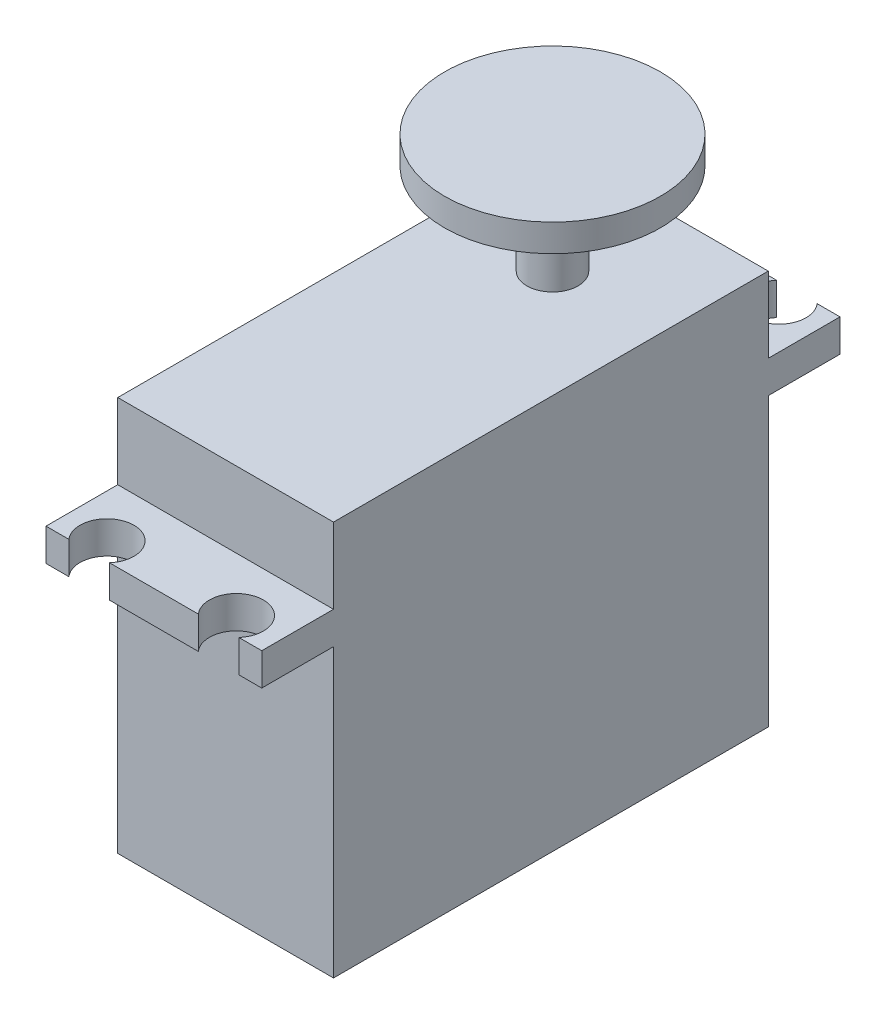
from build123d import *

# Parameters (mm, degrees)
GEAR_START  = 47.6
SKETCH4_R   = 10
GEAR_DEPTH  = 2.54
SKETCH1_W   = 20
SKETCH1_H   = 40.3
BODY_DEPTH  = 36.6
AXLE_REACH  = 50.556
SKETCH2_R   = 2.38125
WINGS_START = 26.6
WINGS_DEPTH = 3


with BuildPart() as part:
    # Sketch4 → Gear (new body)
    with BuildSketch(Plane(origin=(0, 0, 0), x_dir=(1, 0, 0), z_dir=(0, 1, 0)).offset(GEAR_START)):
        Circle(SKETCH4_R)
    extrude(amount=-GEAR_DEPTH)


with BuildPart() as body_2:
    # Sketch1 → Body (new body)
    with BuildSketch(Plane(origin=(0, 0, 0), x_dir=(1, 0, 0), z_dir=(0, 1, 0))):
        with Locations((0, -10.15)):
            Rectangle(SKETCH1_W, SKETCH1_H)
    extrude(amount=BODY_DEPTH)


    # Sketch2 → Axle (add, up to next)
    with BuildSketch(Plane(origin=(0, 36.6, 0), x_dir=(1, 0, 0), z_dir=(0, 1, 0)), mode=Mode.PRIVATE) as axle_sk1:
        Circle(SKETCH2_R)
    axle_tool1 = extrude(axle_sk1.sketch, amount=AXLE_REACH, mode=Mode.PRIVATE) - part.part
    add(axle_tool1.solids().sort_by_distance((0, 36.6, 0))[0])

    # Sketch3 → Wings (add)
    with BuildSketch(Plane(origin=(0, 0, 0), x_dir=(1, 0, 0), z_dir=(0, 1, 0)).offset(WINGS_START)):
        with BuildLine():
            Line((-10, 16.65), (-10, 10))
            Line((-10, 10), (10, 10))
            Line((10, 10), (10, 16.65))
            Line((10, 16.65), (7.878163997, 16.65))
            ThreePointArc((7.878163997, 16.65), (8.339381328, 15.881643354), (8.5, 15))
            ThreePointArc((8.5, 15), (5.118356646, 12.660618672), (4.121836003, 16.65))
            Line((4.121836003, 16.65), (-4.121836003, 16.65))
            ThreePointArc((-4.121836003, 16.65), (-3.660618672, 15.881643354), (-3.5, 15))
            ThreePointArc((-3.5, 15), (-6.881643354, 12.660618672), (-7.878163997, 16.65))
            Line((-7.878163997, 16.65), (-10, 16.65))
        make_face()
    wings = extrude(amount=WINGS_DEPTH)

    # Mirror1: Wings across plane
    add(wings.mirror(Plane.XY.offset(10.15)))


solid = Compound([part.part, body_2.part])
